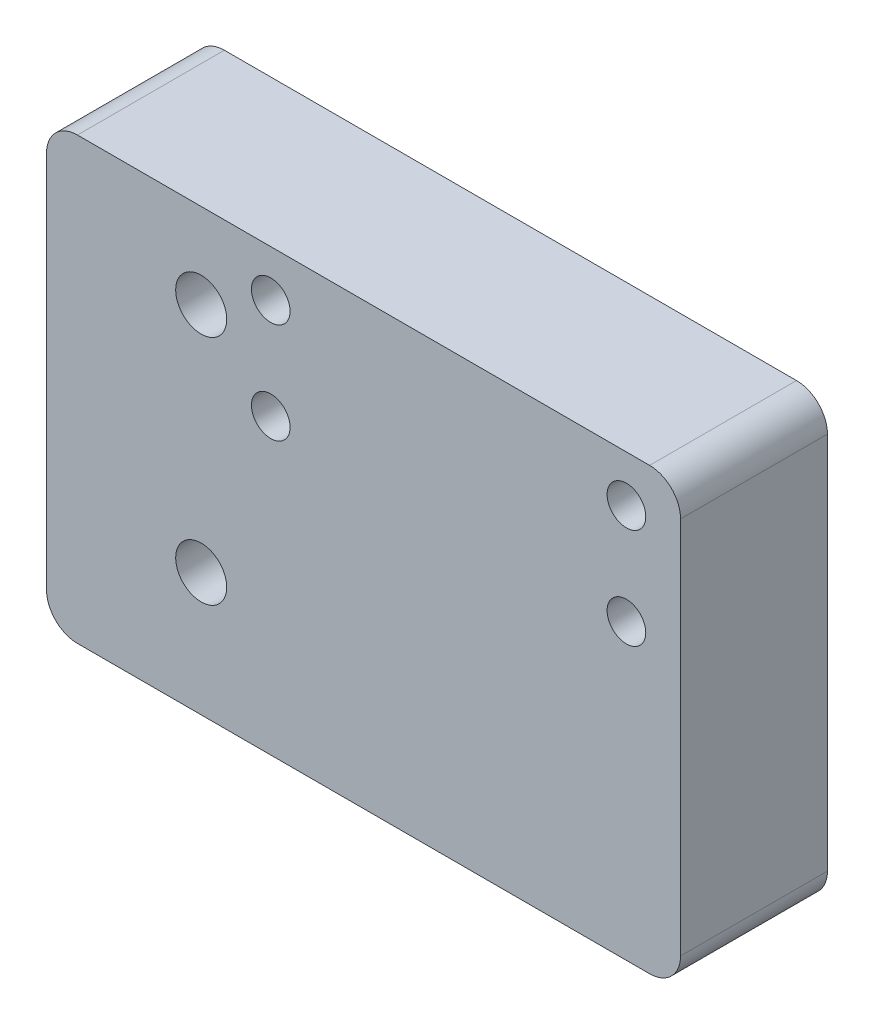
from build123d import *

# Parameters (mm, degrees)
SKETCH1_W                                           = 81.999999998
SKETCH1_H                                           = 60
BOSS_EXTRUDE1_DEPTH                                 = 19
TAP_DRILL_FOR_M6_TAP1_D                             = 5
CSK_FOR_M6_COUNTERSUNK_FLAT_HEAD_SCREW1_D           = 6.6
CSK_FOR_M6_COUNTERSUNK_FLAT_HEAD_SCREW1_CSINK_D     = 12.6
CSK_FOR_M6_COUNTERSUNK_FLAT_HEAD_SCREW1_CSINK_ANGLE = 90
SKETCH7_W                                           = 81.999999998
SKETCH7_H                                           = 4
CUT_EXTRUDE1_DEPTH                                  = 95.50348792
SKETCH10_W                                          = 81.999999998
SKETCH10_H                                          = 0.95
BOSS_EXTRUDE2_DEPTH                                 = 19
FILLET1_R                                           = 4
TAP_DRILL_FOR_M5_TAP1_D                             = 4.2
TAP_DRILL_FOR_M5_TAP1_DEPTH                         = 30
TAP_DRILL_FOR_M5_TAP1_TIP                           = 1.2618073


with BuildPart() as part:
    # Sketch1 → Boss-Extrude1 (new body)
    with BuildSketch(Plane.XY):
        with Locations((20.999999999, 38.745248777)):
            Rectangle(SKETCH1_W, SKETCH1_H)
    extrude(amount=BOSS_EXTRUDE1_DEPTH)

    # Tap Drill for M6 Tap1 (through all)
    with Locations(Plane.XY.offset(19)):
        with Locations((8.999999998, 58.745248777), (54.999999998, 58.745248777), (54.999999998, 45.745248777), (8.999999998, 45.745248777)):
            Hole(TAP_DRILL_FOR_M6_TAP1_D / 2)

    # CSK for M6 Countersunk Flat Head Screw1 (through all)
    with Locations(Plane(origin=(0, 0, 0), x_dir=(1, 0, 0), z_dir=(0, 0, -1))):
        with Locations((0, -23.745248777), (0, -53.745248777)):
            CounterSinkHole(CSK_FOR_M6_COUNTERSUNK_FLAT_HEAD_SCREW1_D / 2, CSK_FOR_M6_COUNTERSUNK_FLAT_HEAD_SCREW1_CSINK_D / 2, counter_sink_angle=CSK_FOR_M6_COUNTERSUNK_FLAT_HEAD_SCREW1_CSINK_ANGLE)

    # Sketch7 → Cut-Extrude1 (cut, through all)
    with BuildSketch(Plane(origin=(0, 0, 0), x_dir=(-1, 0, 0), z_dir=(0, 0, -1))):
        with Locations((-20.999999999, 66.745248777)):
            Rectangle(SKETCH7_W, SKETCH7_H)
    extrude(amount=-CUT_EXTRUDE1_DEPTH, mode=Mode.SUBTRACT)

    # Sketch10 → Boss-Extrude2 (add)
    with BuildSketch(Plane(origin=(0, 0, 0), x_dir=(-1, 0, 0), z_dir=(0, 0, -1))):
        with Locations((-20.999999999, 8.270248777)):
            Rectangle(SKETCH10_W, SKETCH10_H)
    extrude(amount=-BOSS_EXTRUDE2_DEPTH)

    # Fillet1
    fillet1_edges = [part.edges().sort_by_distance(p)[0] for p in [
        (-20, 7.795248777, 9.5),
        (61.999999998, 7.795248777, 9.5),
        (-20, 64.745248777, 9.5),
        (61.999999998, 64.745248777, 9.5),
    ]]
    fillet(fillet1_edges, radius=FILLET1_R)

    # Tap Drill for M5 Tap1
    with Locations(Plane(origin=(0, 7.795248777, 0), x_dir=(-1, 0, 0), z_dir=(0, -1, 0))):
        with Locations((-41.999999998, -9.499999998)):
            Hole(TAP_DRILL_FOR_M5_TAP1_D / 2, depth=TAP_DRILL_FOR_M5_TAP1_DEPTH)
            with Locations((0, 0, -(TAP_DRILL_FOR_M5_TAP1_DEPTH + TAP_DRILL_FOR_M5_TAP1_TIP / 2))):  # 118° drill point
                Cone(0, TAP_DRILL_FOR_M5_TAP1_D / 2, TAP_DRILL_FOR_M5_TAP1_TIP, mode=Mode.SUBTRACT)


solid = part.part
